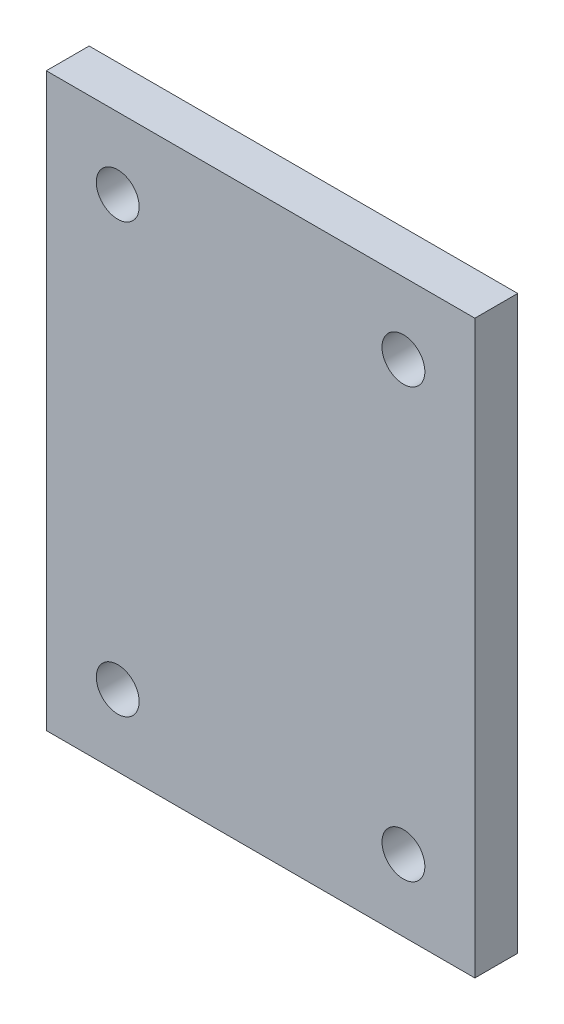
from build123d import *

# Parameters (mm, degrees)
ESQUISSE1_W        = 30
ESQUISSE1_H        = 40
ESQUISSE1_R        = 1.5
BOSS_EXTRU_1_DEPTH = 3


with BuildPart() as part:
    # Esquisse1 → Boss.-Extru.1 (new body)
    with BuildSketch(Plane.XY):
        Rectangle(ESQUISSE1_W, ESQUISSE1_H)
        with Locations((-10, 15)):
            Circle(ESQUISSE1_R, mode=Mode.SUBTRACT)
        with Locations((10, 15)):
            Circle(ESQUISSE1_R, mode=Mode.SUBTRACT)
        with Locations((10, -15)):
            Circle(ESQUISSE1_R, mode=Mode.SUBTRACT)
        with Locations((-10, -15)):
            Circle(ESQUISSE1_R, mode=Mode.SUBTRACT)
    extrude(amount=BOSS_EXTRU_1_DEPTH)


solid = part.part
